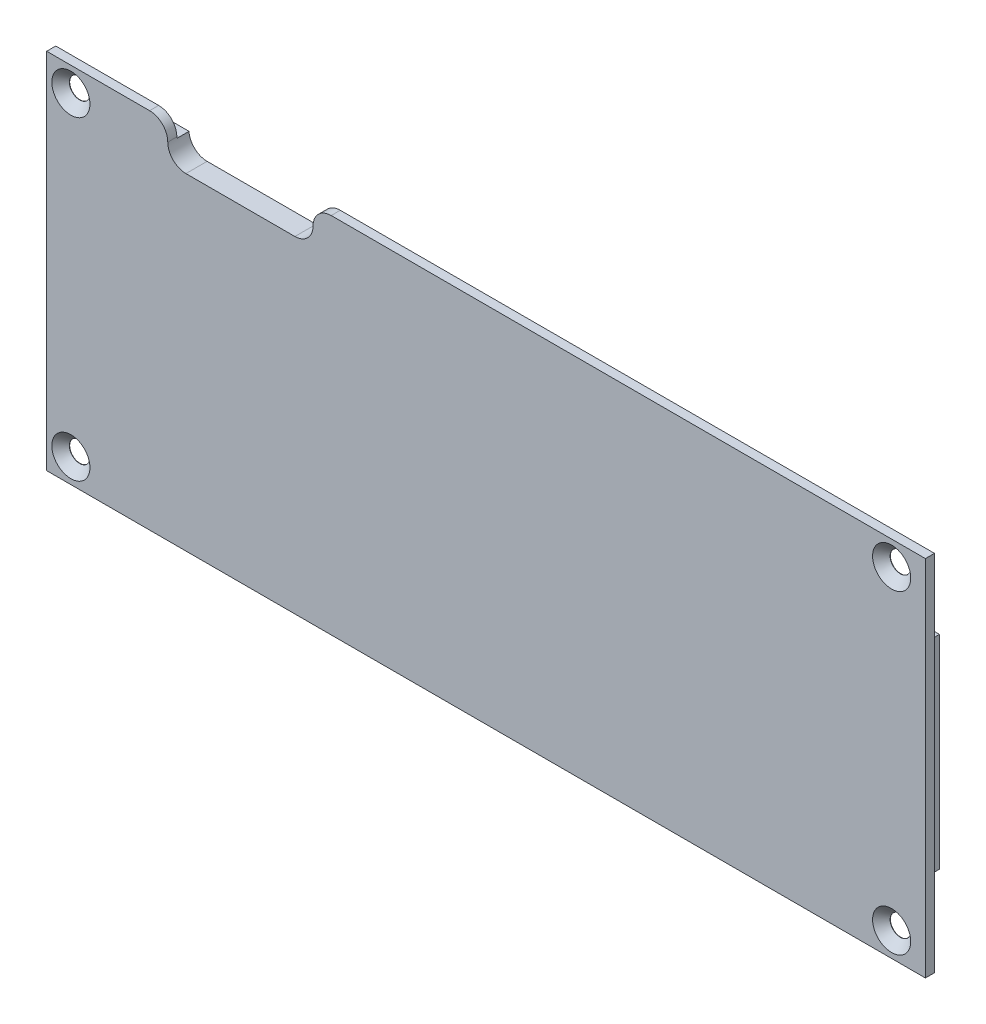
from build123d import *

# Parameters (mm, degrees)
ESQUISSE1_W                                 = 145.148196
ESQUISSE1_H                                 = 60
BOSS_EXTRU_1_DEPTH                          = 1.5
BOSS_EXTRU_2_DEPTH                          = 2
FRAISAGE_POUR_VIS_T_TE_FRAIS_E_M31_AT_COUNT = 2
FRAISAGE_POUR_VIS_T_TE_FRAIS_E_M31_AT_PITCH = 52
FRAISAGE_POUR_VIS_T_TE_FRAIS_E_M31_2_COUNT  = 2
FRAISAGE_POUR_VIS_T_TE_FRAIS_E_M31_2_PITCH  = 135.572178
FRAISAGE_POUR_VIS_T_TE_FRAIS_E_M31_3_COUNT  = 2
FRAISAGE_POUR_VIS_T_TE_FRAIS_E_M31_3_PITCH  = 145.20267025
ENL_V_MAT_EXTRU_1_DEPTH                     = 79.608203774
ENL_V_MAT_EXTRU_1_DEPTH_BACK                = 79.608203774
ESQUISSE6_W                                 = 24
ESQUISSE6_H                                 = 6
CONG_1_R                                    = 3


with BuildPart() as part:
    # Esquisse1 → Boss.-Extru.1 (new body)
    with BuildSketch(Plane.XY):
        Rectangle(ESQUISSE1_W, ESQUISSE1_H)
    extrude(amount=BOSS_EXTRU_1_DEPTH)

    # Esquisse2 → Boss.-Extru.2 (add)
    with BuildSketch(Plane(origin=(0, 0, 0), x_dir=(-1, 0, 0), z_dir=(0, 0, -1))):
        with BuildLine():
            Line((-71.374098, -16.8), (-71.374098, 16.8))
            ThreePointArc((-71.374098, 16.8), (-64.303030188, 19.728932188), (-61.374098, 26.8))
            Line((-61.374098, 26.8), (61.374098, 26.8))
            ThreePointArc((61.374098, 26.8), (64.303030188, 19.728932188), (71.374098, 16.8))
            Line((71.374098, 16.8), (71.374098, -16.8))
            ThreePointArc((71.374098, -16.8), (64.303030188, -19.728932188), (61.374098, -26.8))
            Line((61.374098, -26.8), (-61.374098, -26.8))
            ThreePointArc((-61.374098, -26.8), (-64.303030188, -19.728932188), (-71.374098, -16.8))
        make_face()
    extrude(amount=BOSS_EXTRU_2_DEPTH)

    # Esquisse5 → Fraisage pour vis à tête fraisée M31 (revolve, cut)
    with BuildSketch(Plane(origin=(-68.574098, 26, 1.5), x_dir=(0, -1, 0), z_dir=(1, 0, 0))):
        Polygon((0, 0), (0, 1.5), (1.7, 1.5), (1.7, 1.45), (3.15, 0), align=None)
    fraisage_pour_vis_t_te_frais_e_m31 = revolve(axis=Axis((-68.574098, 26, 7.85), (0, 0, -1)), mode=Mode.SUBTRACT)

    # Fraisage pour vis à tête fraisée M31 at: Fraisage pour vis à tête fraisée M31 ×2
    with Locations(*[(0, -i * FRAISAGE_POUR_VIS_T_TE_FRAIS_E_M31_AT_PITCH, 0) for i in range(1, FRAISAGE_POUR_VIS_T_TE_FRAIS_E_M31_AT_COUNT)]):
        add(fraisage_pour_vis_t_te_frais_e_m31, mode=Mode.SUBTRACT)

    # Fraisage pour vis _ t_te frais_e M31 2: Fraisage pour vis à tête fraisée M31 ×2
    with Locations(*[(i * FRAISAGE_POUR_VIS_T_TE_FRAIS_E_M31_2_PITCH, 0, 0) for i in range(1, FRAISAGE_POUR_VIS_T_TE_FRAIS_E_M31_2_COUNT)]):
        add(fraisage_pour_vis_t_te_frais_e_m31, mode=Mode.SUBTRACT)

    # Fraisage pour vis _ t_te frais_e M31 3: Fraisage pour vis à tête fraisée M31 ×2
    with Locations(*[Vector(0.9336755155176905, -0.35812013588009123, 0) * (i * FRAISAGE_POUR_VIS_T_TE_FRAIS_E_M31_3_PITCH) for i in range(1, FRAISAGE_POUR_VIS_T_TE_FRAIS_E_M31_3_COUNT)]):
        add(fraisage_pour_vis_t_te_frais_e_m31, mode=Mode.SUBTRACT)

    # Esquisse6 → Enlèv. mat.-Extru.1 (cut, two sides: drawn at the far end of the back side and taken through both)
    with BuildSketch(Plane.XY.offset(1.5).offset(-ENL_V_MAT_EXTRU_1_DEPTH_BACK)):
        with Locations((-40.574098, 27)):
            Rectangle(ESQUISSE6_W, ESQUISSE6_H)
    extrude(amount=ENL_V_MAT_EXTRU_1_DEPTH + ENL_V_MAT_EXTRU_1_DEPTH_BACK, mode=Mode.SUBTRACT)

    # Congé1
    cong_1_edges = [part.edges().sort_by_distance(p)[0] for p in [
        (-28.574098, 30, 0.75),
        (-28.574098, 24, -0.25),
        (-52.574098, 30, 0.75),
        (-52.574098, 24, -0.25),
    ]]
    fillet(cong_1_edges, radius=CONG_1_R - 0.0001)  # a hair under: the kernel refuses the full size


solid = part.part
